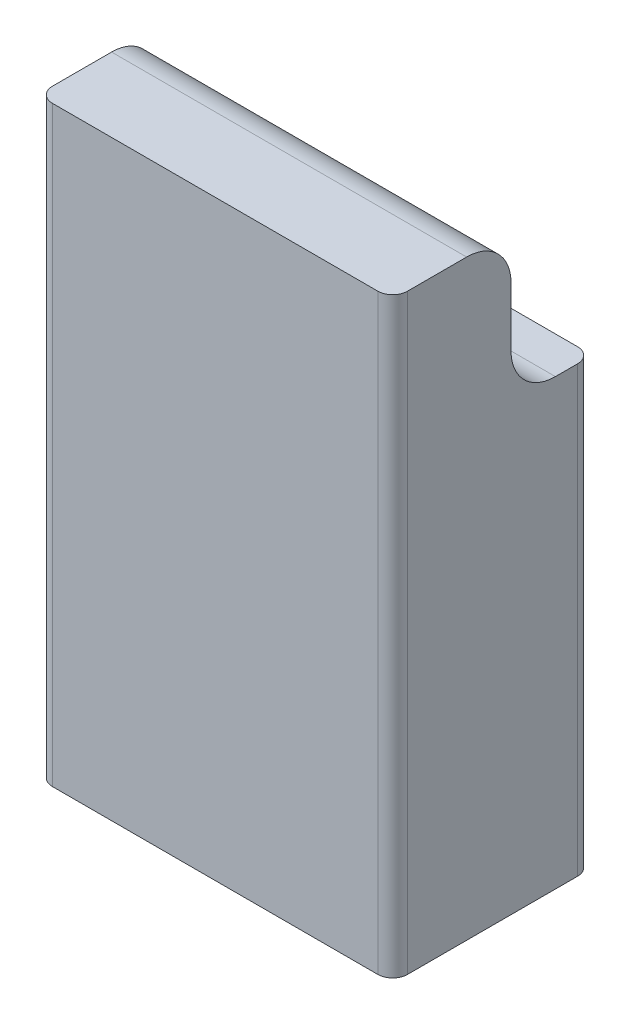
from build123d import *

# Parameters (mm, degrees)
SKETCH1_W                   = 24
SKETCH1_H                   = 13.5
BOSS_EXTRUDE1_DEPTH         = 40
CUT_EXTRUDE1_REACH          = 49.133
FILLET1_R                   = 3
FILLET2_R                   = 1
M6_TAPPED_HOLE1_D           = 5
M6_TAPPED_HOLE1_DEPTH       = 17
M6_TAPPED_HOLE1_CSINK_D     = 6.05
M6_TAPPED_HOLE1_CSINK_ANGLE = 90
M6_TAPPED_HOLE1_TIP         = 1.502151548


with BuildPart() as part:
    # Sketch1 → Boss-Extrude1 (new body)
    with BuildSketch(Plane(origin=(0, 0, 0), x_dir=(1, 0, 0), z_dir=(0, 1, 0))):
        Rectangle(SKETCH1_W, SKETCH1_H)
    extrude(amount=-BOSS_EXTRUDE1_DEPTH)

    # Sketch2 → Cut-Extrude1 (cut, up to next)
    with BuildSketch(Plane(origin=(12, 0, 0), x_dir=(0, 0, -1), z_dir=(1, 0, 0)), mode=Mode.PRIVATE) as cut_extrude1_sk1:
        with BuildLine():
            Line((1.25, 0), (6.75, 0))
            Line((6.75, 0), (6.75, -10))
            Line((6.75, -10), (4.25, -10))
            ThreePointArc((4.25, -10), (2.128679656, -9.121320344), (1.25, -7))
            Line((1.25, -7), (1.25, 0))
        make_face()
    cut_extrude1_tool1 = extrude(cut_extrude1_sk1.sketch, amount=-CUT_EXTRUDE1_REACH, mode=Mode.PRIVATE) & part.part
    add(cut_extrude1_tool1.solids().sort_by_distance((12, -4.842415, -4.075697))[0], mode=Mode.SUBTRACT)

    # Fillet1
    fillet1_edges = [part.edges().sort_by_distance(p)[0] for p in [
        (0, 0, -1.25),
    ]]
    fillet(fillet1_edges, radius=FILLET1_R)

    # Fillet2
    fillet2_edges = [part.edges().sort_by_distance(p)[0] for p in [
        (-12, -20, 6.75),
        (12, -20, 6.75),
        (-12, -25, -6.75),
        (12, -25, -6.75),
    ]]
    fillet(fillet2_edges, radius=FILLET2_R)

    # M6 Tapped Hole1
    with Locations(Plane(origin=(0, -40, 0), x_dir=(-1, 0, 0), z_dir=(0, -1, 0))):
        with Locations((0, 0)):
            CounterSinkHole(M6_TAPPED_HOLE1_D / 2, M6_TAPPED_HOLE1_CSINK_D / 2, depth=M6_TAPPED_HOLE1_DEPTH, counter_sink_angle=M6_TAPPED_HOLE1_CSINK_ANGLE)
            with Locations((0, 0, -(M6_TAPPED_HOLE1_DEPTH + M6_TAPPED_HOLE1_TIP / 2))):  # 118° drill point
                Cone(0, M6_TAPPED_HOLE1_D / 2, M6_TAPPED_HOLE1_TIP, mode=Mode.SUBTRACT)


solid = part.part
